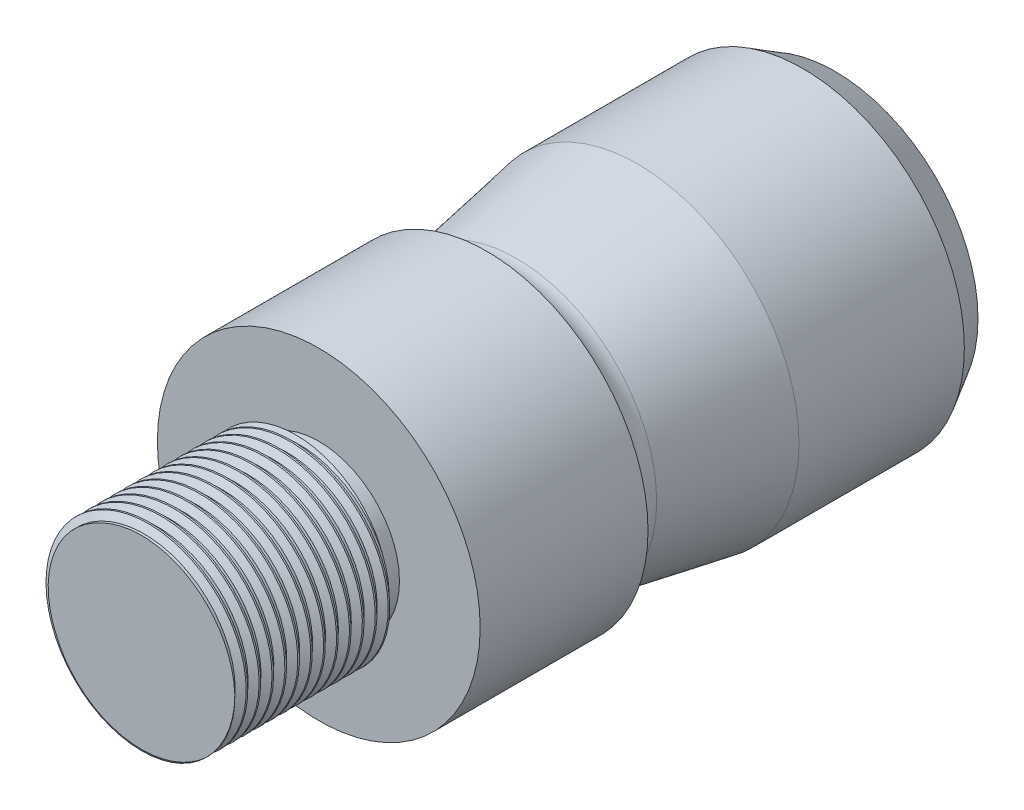
from build123d import *

# Parameters (mm, degrees)
THREAD1_PITCH = 2


with BuildPart() as part:
    # Sketch3 → Revolve1 (revolve)
    with BuildSketch(Plane(origin=(0, 0, 0), x_dir=(1, 0, 0), z_dir=(0, 1, 0))):
        with BuildLine():
            Line((40.779576321, 111.476964441), (62.892824975, 111.476964441))
            Line((62.892824975, 111.476964441), (65.779576321, 106.476964441))
            Line((65.779576321, 106.476964441), (65.779576321, 80.867399642))
            Line((65.779576321, 80.867399642), (62.474169032, 62.121503376))
            ThreePointArc((62.474169032, 62.121503376), (63.136791867, 59.13260492), (65.718807333, 57.487679653))
            Line((65.718807333, 57.487679653), (65.779576321, 57.476964441))
            Line((65.779576321, 57.476964441), (65.779576321, 31.476964441))
            Line((65.779576321, 31.476964441), (53.279576321, 31.476964441))
            Line((53.279576321, 31.476964441), (53.279576321, 28.476964441))
            Line((53.279576321, 28.476964441), (55.779576321, 28.476964441))
            Line((55.779576321, 28.476964441), (55.779576321, 3.476964441))
            Line((55.779576321, 3.476964441), (40.779576321, 3.476964441))
            Line((40.779576321, 3.476964441), (40.779576321, 111.476964441))
        make_face()
    revolve(axis=Axis((40.779576321, 0, -3.476964441), (0, 0, -1)))

    # Thread1: the profile of Thread Profile1 profile screwed along a right-hand helix of 15.5 turns, 10 arcs to a turn; built about Z, then put on its axis
    thread1_z = Axis((0, 0, 0), (0, 0, 1))
    thread1_corners = [(15.0003, 0, -0.000173205), (15.0003, 0, 1.750173199), (13.91746825, 0, 1.124999997), (13.91746825, 0, 0.624999997)]
    with BuildLine(mode=Mode.PRIVATE) as thread1_profile:
        Line(thread1_corners[0], thread1_corners[1])
        Line(thread1_corners[1], thread1_corners[2])
        Line(thread1_corners[2], thread1_corners[3])
        Line(thread1_corners[3], thread1_corners[0])
    thread1_cap = Face(thread1_profile.wire())
    thread1_turn_angles = [0, 18, 36, 54, 72, 90, 108, 126, 144, 162, 180, 198, 216, 234, 252, 270, 288, 306, 324, 342, 360]
    thread1_turn_weights = [1, 0.9510565162951535, 1, 0.9510565162951535, 1, 0.9510565162951535, 1, 0.9510565162951535, 1, 0.9510565162951535, 1, 0.9510565162951535, 1, 0.9510565162951535, 1, 0.9510565162951535, 1, 0.9510565162951535, 1, 0.9510565162951535, 1]
    thread1_turn_rails = [Edge.make_bspline([Vector(p[0], p[1], 0).rotate(thread1_z, thread1_turn_angles[k]) / thread1_turn_weights[k] + Vector(0, 0, p[2] + THREAD1_PITCH * thread1_turn_angles[k] / 360) for k in range(21)], [0, 0, 0, 1, 1, 2, 2, 3, 3, 4, 4, 5, 5, 6, 6, 7, 7, 8, 8, 9, 9, 10, 10, 10], 2, thread1_turn_weights) for p in thread1_corners]
    thread1_turn_sides = [Face.make_surface_from_curves(thread1_turn_rails[p[0]], thread1_turn_rails[p[1]]) for p in [(0, 1), (1, 2), (2, 3), (3, 0)]]
    thread1_last_angles = [5400, 5418, 5436, 5454, 5472, 5490, 5508, 5526, 5544, 5562, 5580]
    thread1_last_weights = [1, 0.9510565162951535, 1, 0.9510565162951535, 1, 0.9510565162951535, 1, 0.9510565162951535, 1, 0.9510565162951535, 1]
    thread1_last_rails = [Edge.make_bspline([Vector(p[0], p[1], 0).rotate(thread1_z, thread1_last_angles[k]) / thread1_last_weights[k] + Vector(0, 0, p[2] + THREAD1_PITCH * thread1_last_angles[k] / 360) for k in range(11)], [0, 0, 0, 1, 1, 2, 2, 3, 3, 4, 4, 5, 5, 5], 2, thread1_last_weights) for p in thread1_corners]
    thread1_last_sides = [Face.make_surface_from_curves(thread1_last_rails[p[0]], thread1_last_rails[p[1]]) for p in [(0, 1), (1, 2), (2, 3), (3, 0)]]
    thread1 = Plane(origin=(40.779576321, 0, 1.523035559), x_dir=(-1, 0, 0), z_dir=(0, 0, -1)) * Solid(Shell([*[p.moved(Location((0, 0, THREAD1_PITCH * i))) for i in range(15) for p in thread1_turn_sides], *thread1_last_sides, thread1_cap, thread1_cap.rotate(thread1_z, 5580).moved(Location((0, 0, THREAD1_PITCH * 5580 / 360)))]))
    add(thread1, mode=Mode.SUBTRACT)


solid = part.part
